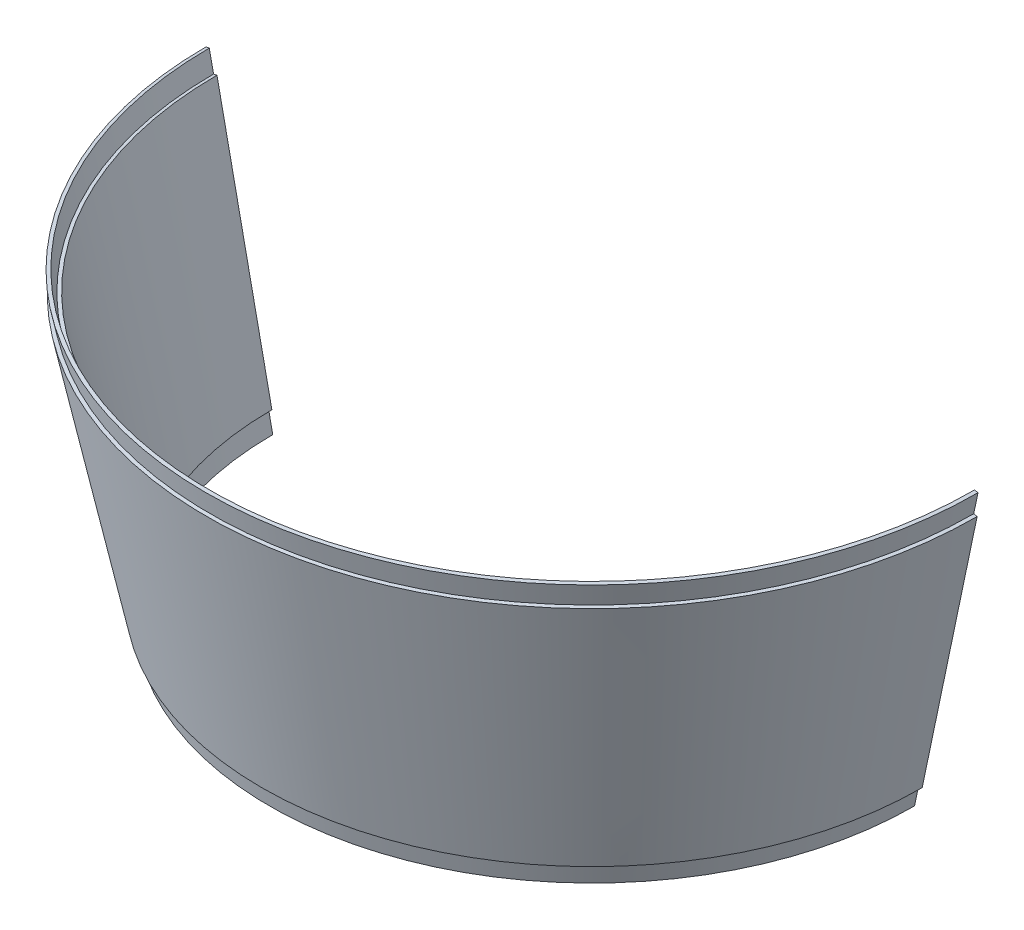
from build123d import *

# Parameters (mm, degrees)
RIB5_START          = -1.5875
RIB5_DEPTH          = 3.175
CIRPATTERN1_COUNT   = 4
BOSS_EXTRUDE1_REACH = 604.818
SKETCH4_R           = 50.8
SKETCH4_R_2         = 44.45
SKETCH4_3_R         = 44.45
CUT_EXTRUDE1_DEPTH  = 155.575
SKETCH16_R          = 47.625
SKETCH16_R_2        = 44.45
CUT_EXTRUDE8_DEPTH  = 165.1
BOSS_EXTRUDE2_START = 127
SKETCH10_R          = 53.975
SKETCH10_R_2        = 50.8
BOSS_EXTRUDE2_DEPTH = 127
RIB10_START         = -3.175
RIB10_DEPTH         = 3.175
SKETCH12_R          = 50.8
CUT_EXTRUDE4_DEPTH  = 9.525
SKETCH17_R          = 3.175
CUT_EXTRUDE9_DEPTH  = 3.175
SKETCH18_W          = 50.8
SKETCH18_H          = 130.175
SKETCH19_W          = 254
SKETCH19_H          = 114.3
CUT_EXTRUDE10_DEPTH = 326.542078986


with BuildPart() as part:
    # Sketch1 → Revolve-Thin1 (revolve)
    with BuildSketch(Plane.XY, mode=Mode.PRIVATE) as revolve_thin1_sk:
        Polygon((-104.775, 0), (-60.325, 0), (-158.75, 469.9), (-50.8, 469.9), (-50.8, 466.725), (-154.841065026, 466.725), (-56.416065026, -3.175), (-104.775, -3.175), align=None)
    revolve(revolve_thin1_sk.sketch.rotate(Axis((0, 0, 0), (0, 1, 0)), 270), axis=Axis((0, 0, 0), (0, 1, 0)))

    # Rib5: read off the stored shape, not the designer's step
    # Rib5 outline → Rib5 (add)
    with BuildSketch(Plane(origin=(0, 0, 0), x_dir=(0, 0, -1), z_dir=(1, 0, 0)).offset(RIB5_START)):
        with BuildLine():
            add(Edge.make_bspline(
                [(-60.304108235, -2e-09), (-60.337817831, 0.160880416), (-60.371527408, 0.321760839), (-62.968360223, 12.715265359), (-65.531376886, 24.947911788), (-71.07360722, 51.400397829), (-74.052795216, 65.620242821), (-77.031911205, 79.840102899)],
                knots=[1388.368707512, 1388.368707512, 1388.368707512, 1388.368707512, 1388.861829823, 1388.861829823, 1426.356632629, 1426.356632629, 1469.942363945, 1469.942363945, 1469.942363945, 1469.942363945], degree=3))
            Line((-77.031911205, 79.840102899), (-98.425, 0))
            Line((-98.425, 0), (-60.304108235, -2e-09))
        make_face()
    rib5 = extrude(amount=RIB5_DEPTH)

    # CirPattern1: Rib5 ×4 about axis
    cirpattern1_axis = Axis((0, 0, 0), (0, 1, 0))
    for i in range(1, CIRPATTERN1_COUNT):
        add(rib5.rotate(cirpattern1_axis, i * 360 / CIRPATTERN1_COUNT))

    # Sketch4 → Boss-Extrude1 (add, up to next)
    with BuildSketch(Plane(origin=(0, 41.317067623, 234.320734449), x_dir=(-1, 0, 0), z_dir=(0, 0.17364817766693072, 0.984807753012208)), mode=Mode.PRIVATE) as boss_extrude1_sk1:
        with Locations(Location((-89.350924276, -380.21116314, 0), (0, 0, 90))):
            Circle(SKETCH4_R)
        with Locations(Location((-89.350924276, -380.21116314, 0), (0, 0, 90))):
            Circle(SKETCH4_R_2, mode=Mode.SUBTRACT)
    boss_extrude1_tool1 = extrude(boss_extrude1_sk1.sketch, amount=-BOSS_EXTRUDE1_REACH, mode=Mode.PRIVATE) - part.part
    add(boss_extrude1_tool1.solids().sort_by_distance((89.350924, 464.365191, 159.725936))[0])

    # Sketch4<3> → Cut-Extrude1 (cut)
    with BuildSketch(Plane(origin=(0, 41.317067623, 234.320734449), x_dir=(-1, 0, 0), z_dir=(0, 0.17364817766693072, 0.984807753012208))):
        with Locations(Location((-89.350924276, -380.21116314, 0), (0, 0, 90))):
            Circle(SKETCH4_3_R)
    extrude(amount=-CUT_EXTRUDE1_DEPTH, mode=Mode.SUBTRACT)

    # Sketch16 → Cut-Extrude8 (cut)
    # profile 1 of 2: a face of its own
    with BuildSketch(Plane(origin=(0, 41.317067623, 234.320734449), x_dir=(1, 0, 0), z_dir=(0, 0.17364817766693058, 0.9848077530122081))):
        with Locations(Location((89.350924276, 380.21116314, 0), (0, 0, 270))):
            Circle(SKETCH16_R)
        with Locations((89.350924276, 380.21116314)):
            Circle(SKETCH16_R_2, mode=Mode.SUBTRACT)
    # profile 2 of 2: a face of its own
    with BuildSketch(Plane(origin=(0, 41.317067623, 234.320734449), x_dir=(1, 0, 0), z_dir=(0, 0.17364817766693058, 0.9848077530122081))):
        with Locations((89.350924276, 380.21116314)):
            Circle(SKETCH16_R_2)
    extrude(amount=-CUT_EXTRUDE8_DEPTH, mode=Mode.SUBTRACT)

    # Sketch10 → Boss-Extrude2 (add)
    with BuildSketch(Plane.XZ.offset(-466.725).offset(BOSS_EXTRUDE2_START)):
        with Locations(Location((0, 0, 0), (0, 0, 90))):
            Circle(SKETCH10_R)
        with Locations(Location((0, 0, 0), (0, 0, 270))):
            Circle(SKETCH10_R_2, mode=Mode.SUBTRACT)
    extrude(amount=-BOSS_EXTRUDE2_DEPTH)

    # Rib10: read off the stored shape, not the designer's step
    # Rib10 outline → Rib10 (add)
    with BuildSketch(Plane(origin=(41.275, 0, 0), x_dir=(0, 0, -1), z_dir=(1, 0, 0)).offset(RIB10_START)):
        with BuildLine():
            Line((-129.397511049, 371.475000111), (-34.780382402, 371.475))
            Line((-34.780382402, 371.475), (-34.780382402, 466.725))
            Line((-34.780382402, 466.725), (-150.08046179, 466.725000293))
            add(Edge.make_bspline(
                [(-129.397511049, 371.475000111), (-129.621022333, 372.498635621), (-129.844489601, 373.522280745), (-132.947477272, 387.73914033), (-135.819852259, 400.933914587), (-140.797597402, 423.849651078), (-142.905681683, 433.570024076), (-146.702544816, 451.101957641), (-148.392325081, 458.913301347), (-150.08046179, 466.725000293)],
                knots=[195.059408085, 195.059408085, 195.059408085, 195.059408085, 198.202667885, 198.202667885, 238.714059285, 238.714059285, 268.553076365, 268.553076365, 292.529147638, 292.529147638, 292.529147638, 292.529147638], degree=3))
        make_face()
    extrude(amount=RIB10_DEPTH)

    # Sketch12 → Cut-Extrude4 (cut)
    with BuildSketch(Plane(origin=(0, 41.317067623, 234.320734449), x_dir=(1, 0, 0), z_dir=(0, 0.17364817766693058, 0.9848077530122081))):
        with Locations(Location((89.350924276, 380.21116314, 0), (0, 0, 270))):
            Circle(SKETCH12_R)
    extrude(amount=-CUT_EXTRUDE4_DEPTH, mode=Mode.SUBTRACT)

    # Sketch17 → Cut-Extrude9 (cut)
    with BuildSketch(Plane.XZ.offset(3.175)):
        with Locations(Location((-62.861792847, 62.861792847, 0), (0, 0, 270))):
            Circle(SKETCH17_R)
        with Locations(Location((-34.020557137, 82.13289044, 0), (0, 0, 270))):
            Circle(SKETCH17_R)
        with Locations(Location((34.020557137, 82.13289044, 0), (0, 0, 270))):
            Circle(SKETCH17_R)
        with Locations(Location((62.861792847, 62.861792847, 0), (0, 0, 270))):
            Circle(SKETCH17_R)
        with Locations(Location((82.13289044, 34.020557137, 0), (0, 0, 270))):
            Circle(SKETCH17_R)
        with Locations(Location((82.13289044, -34.020557137, 0), (0, 0, 270))):
            Circle(SKETCH17_R)
        with Locations(Location((62.861792847, -62.861792847, 0), (0, 0, 270))):
            Circle(SKETCH17_R)
        with Locations(Location((34.020557137, -82.13289044, 0), (0, 0, 270))):
            Circle(SKETCH17_R)
        with Locations(Location((-34.020557137, -82.13289044, 0), (0, 0, 270))):
            Circle(SKETCH17_R)
        with Locations(Location((-62.861792847, -62.861792847, 0), (0, 0, 270))):
            Circle(SKETCH17_R)
        with Locations(Location((-82.13289044, -34.020557137, 0), (0, 0, 270))):
            Circle(SKETCH17_R)
        with Locations(Location((-82.13289044, 34.020557137, 0), (0, 0, 270))):
            Circle(SKETCH17_R)
    extrude(amount=-CUT_EXTRUDE9_DEPTH, mode=Mode.SUBTRACT)

    # Sketch18 → Cut-Revolve2 (revolve, cut)
    with BuildSketch(Plane.XY, mode=Mode.PRIVATE) as cut_revolve2_sk:
        Polygon((-114.410343119, 273.700908317), (-154.841065026, 466.725), (-56.416065026, 339.725), (-53.975, 339.725), (-50.8, 339.725), (-50.8, 469.9), (-158.75, 469.9), (-117.517905405, 273.05), (-116.48205131, 273.266969439), (-117.783867943, 279.482094012), (-116.748013848, 279.69906345), (-115.446197215, 273.483938878), align=None)
        Polygon((-56.416065026, -3.175), (-97.64815962, 193.675), (-98.684013716, 193.458030561), (-97.382197082, 187.242905988), (-98.418051178, 187.02593655), (-99.719867811, 193.241061122), (-100.755721907, 193.024091683), (-77.041088772, 79.805843168), (-98.425, 0), (-104.775, 0), (-104.775, -3.175), align=None)
        with Locations((-25.4, 404.8125)):
            Rectangle(SKETCH18_W, SKETCH18_H)
    revolve(cut_revolve2_sk.sketch.rotate(Axis((0, 0, 0), (0, 1, 0)), 270), axis=Axis((0, 0, 0), (0, 1, 0)), mode=Mode.SUBTRACT)


with BuildPart() as cut_revolve2_kept_piece:
    # of the separate pieces the step leaves, the one the design keeps (cut_revolve2_pieces_kept)
    add(part.part.solids().sort_by_distance((0, 193.024091683, -100.755721907))[0])

    # Sketch19 → Cut-Extrude10 (cut, through all)
    with BuildSketch(Plane.XY):
        with Locations((0, 233.254015281)):
            Rectangle(SKETCH19_W, SKETCH19_H)
    extrude(amount=-CUT_EXTRUDE10_DEPTH, mode=Mode.SUBTRACT)


solid = cut_revolve2_kept_piece.part
